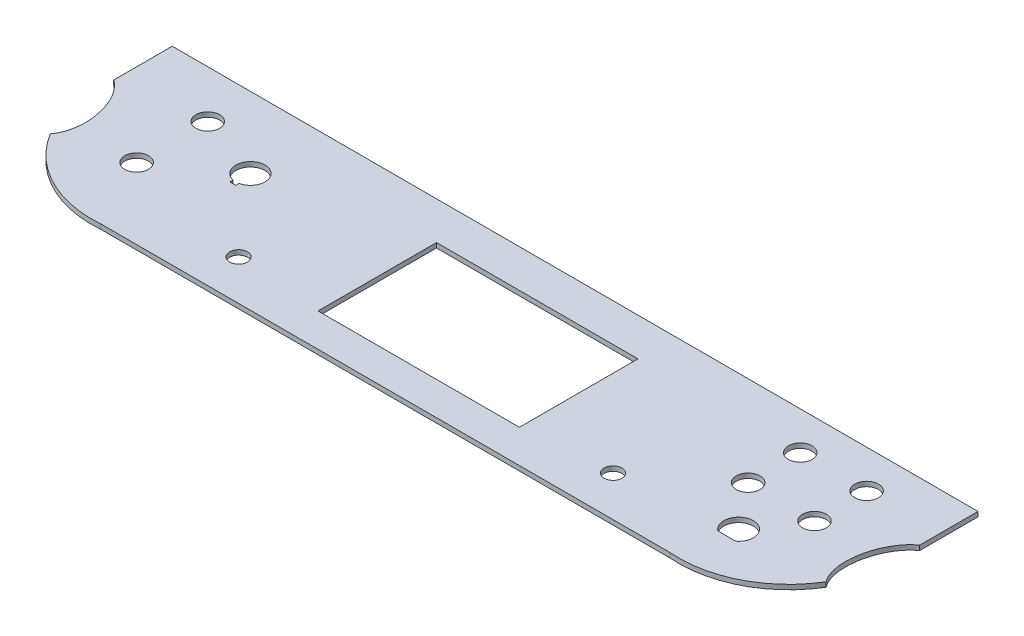
from build123d import *

# Parameters (mm, degrees)
BOSS_EXTRUDE1_DEPTH = 2.54
SKETCH2_W           = 107.95
SKETCH2_H           = 63.5
CUT_EXTRUDE1_DEPTH  = 226.664855764
CUT_EXTRUDE2_START  = -2.54
CUT_EXTRUDE2_DEPTH  = 2.54
SKETCH4_R           = 4.7625
SKETCH4_R_2         = 6.35
CUT_EXTRUDE3_DEPTH  = 226.66485589


# Read off the part's stored shape, not the designer's step: Cut-Extrude2
with BuildPart() as part:
    # Sketch1 → Boss-Extrude1 (new body)
    with BuildSketch(Plane(origin=(0, 0, 0), x_dir=(1, 0, 0), z_dir=(0, 1, 0))):
        with BuildLine():
            Line((215.9, -14.612459999), (215.9, 36.187540001))
            Line((215.9, 36.187540001), (-215.9, 36.187540001))
            Line((-215.9, 36.187540001), (-215.9, -14.612459999))
            ThreePointArc((-215.9, -14.612459999), (-194.259204241, -52.648965299), (-152.4, -65.412459999))
            Line((-152.4, -65.412459999), (152.4, -65.412459999))
            ThreePointArc((152.4, -65.412459999), (194.259204241, -52.648965299), (215.9, -14.612459999))
        make_face()
    extrude(amount=BOSS_EXTRUDE1_DEPTH)

    # Sketch2 → Cut-Extrude1 (cut, through all)
    with BuildSketch(Plane(origin=(0, 2.54, 0), x_dir=(1, 0, 0), z_dir=(0, 1, 0))):
        with Locations((0, -15.875)):
            Rectangle(SKETCH2_W, SKETCH2_H)
    extrude(amount=-CUT_EXTRUDE1_DEPTH, mode=Mode.SUBTRACT)

    # Cut-Extrude2 outline → Cut-Extrude2 (cut)
    with BuildSketch(Plane(origin=(0, 2.54, 0), x_dir=(1, 0, 0), z_dir=(0, 1, 0)).offset(CUT_EXTRUDE2_START)):
        with BuildLine():
            add(Edge.make_bspline(
                [(-215.899999994, 4.835115527), (-215.566109371, 4.600913161), (-214.20332449, 3.575815014), (-211.81883724, 1.254885046), (-208.930212321, -2.798021616), (-206.463783195, -7.807066224), (-204.667192604, -13.474398824), (-203.719076257, -19.343595697), (-203.665482888, -24.926688771), (-204.419435916, -29.846217321), (-205.817811739, -33.905445303), (-207.110427717, -36.090029013), (-207.840384867, -37.055481676), (-207.892164085, -37.122761751)],
                knots=[0.114839475, 0.114839475, 0.114839475, 0.114839475, 0.125, 0.15625, 0.1875, 0.21875, 0.25, 0.28125, 0.3125, 0.34375, 0.375, 0.40625, 0.408621758, 0.408621758, 0.408621758, 0.408621758], degree=3))
            Line((-215.899999994, 4.835115527), (-215.9, -14.612459999))
            ThreePointArc((-215.9, -14.612459999), (-213.044051445, -26.27599059), (-207.892164085, -37.122761751))
        make_face()
        with BuildLine():
            add(Edge.make_bspline(
                [(207.868044886, -37.162504966), (207.809793398, -37.087410994), (207.071460176, -36.116522204), (205.76942942, -33.924763186), (204.364219868, -29.86852613), (203.602011314, -24.951147017), (203.646262202, -19.369088999), (204.584578872, -13.499601085), (206.371728131, -7.830613162), (208.829838854, -2.818725142), (211.711764265, 1.237884913), (214.130027538, 3.598772476), (215.528958726, 4.645764848), (215.899999994, 4.902596054)],
                knots=[0.09109108, 0.09109108, 0.09109108, 0.09109108, 0.09375, 0.125, 0.15625, 0.1875, 0.21875, 0.25, 0.28125, 0.3125, 0.34375, 0.375, 0.386307936, 0.386307936, 0.386307936, 0.386307936], degree=3))
            ThreePointArc((207.868044886, -37.162504966), (213.03625635, -26.297889248), (215.9, -14.612459999))
            Line((215.9, -14.612459999), (215.899999994, 4.902596054))
        make_face()
    extrude(amount=CUT_EXTRUDE2_DEPTH, mode=Mode.SUBTRACT)

    # Sketch4 → Cut-Extrude3 (cut, through all)
    with BuildSketch(Plane(origin=(0, 2.54, 0), x_dir=(1, 0, 0), z_dir=(0, 1, 0))):
        with Locations(Location((100.33, -43.822459999, 0), (0, 0, 270))):
            Circle(SKETCH4_R)
        with Locations(Location((140.97, -12.072459999, 0), (0, 0, 270))):
            Circle(SKETCH4_R_2)
        with Locations(Location((140.97, 15.867540001, 0), (0, 0, 270))):
            Circle(SKETCH4_R_2)
        with Locations(Location((176.53, 15.867540001, 0), (0, 0, 270))):
            Circle(SKETCH4_R_2)
        with Locations(Location((-100.33, -43.822459999, 0), (0, 0, 270))):
            Circle(SKETCH4_R)
        with Locations(Location((-171.45, -27.312459999, 0), (0, 0, 270))):
            Circle(SKETCH4_R_2)
        with Locations(Location((-171.45, 10.787540001, 0), (0, 0, 270))):
            Circle(SKETCH4_R_2)
        with Locations(Location((176.53, -12.072459999, 0), (0, 0, 270))):
            Circle(SKETCH4_R_2)
        with BuildLine():
            Line((164.7825, -42.552459999), (155.2575, -42.552459999))
            ThreePointArc((155.2575, -42.552459999), (160.02, -28.264959999), (164.7825, -42.552459999))
        make_face()
        with BuildLine():
            Line((-134.3025, -9.559927161), (-134.3025, -11.337927161))
            Line((-134.3025, -11.337927161), (-137.4775, -11.337927161))
            Line((-137.4775, -11.337927161), (-137.4775, -9.559927161))
            ThreePointArc((-137.4775, -9.559927161), (-135.89, 5.898040001), (-134.3025, -9.559927161))
        make_face()
    extrude(amount=-CUT_EXTRUDE3_DEPTH, mode=Mode.SUBTRACT)


solid = part.part
